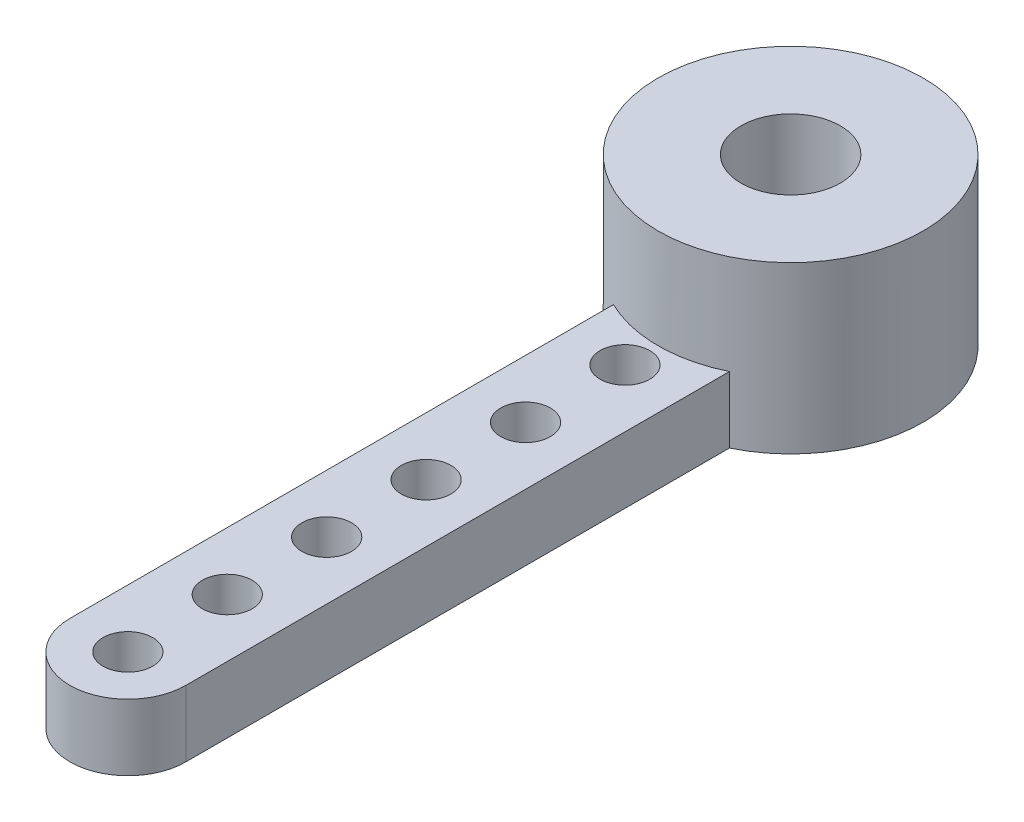
from build123d import *
from build123d.topology import SkipClean

# Parameters (mm, degrees)
SKETCH1_R           = 1.5
BOSS_EXTRUDE1_DEPTH = 10
SKETCH2_R           = 3
CUT_EXTRUDE1_DEPTH  = 6
SKETCH3_R           = 1.5
CUT_EXTRUDE2_DEPTH  = 6
CUT_EXTRUDE4_START  = -6
CUT_EXTRUDE4_DEPTH  = 6


with BuildPart() as part:
    # Sketch1 → Boss-Extrude1 (new body)
    with BuildSketch(Plane(origin=(0, 0, 0), x_dir=(1, 0, 0), z_dir=(0, 1, 0))):
        with BuildLine():
            Line((-3.5, -7.193747285), (-3.5, -40))
            ThreePointArc((-3.5, -40), (0, -43.5), (3.5, -40))
            Line((3.5, -40), (3.5, -7.193747285))
            ThreePointArc((3.5, -7.193747285), (0, 8), (-3.5, -7.193747285))
        make_face()
        with Locations((0, -10)):
            Circle(SKETCH1_R, mode=Mode.SUBTRACT)
        with Locations((0, -34)):
            Circle(SKETCH1_R, mode=Mode.SUBTRACT)
        with Locations((0, -28)):
            Circle(SKETCH1_R, mode=Mode.SUBTRACT)
        with Locations((0, -22)):
            Circle(SKETCH1_R, mode=Mode.SUBTRACT)
        with Locations((0, -40)):
            Circle(SKETCH1_R, mode=Mode.SUBTRACT)
        with Locations((0, -16)):
            Circle(SKETCH1_R, mode=Mode.SUBTRACT)
    extrude(amount=BOSS_EXTRUDE1_DEPTH)

    # Sketch2 → Cut-Extrude1 (cut)
    with BuildSketch(Plane(origin=(0, 10, 0), x_dir=(1, 0, 0), z_dir=(0, 1, 0))):
        Circle(SKETCH2_R)
    extrude(amount=-CUT_EXTRUDE1_DEPTH, mode=Mode.SUBTRACT)

    # Sketch3 → Cut-Extrude2 (cut)
    with BuildSketch(Plane(origin=(0, 4, 0), x_dir=(1, 0, 0), z_dir=(0, 1, 0))):
        Circle(SKETCH3_R)
    extrude(amount=-CUT_EXTRUDE2_DEPTH, mode=Mode.SUBTRACT)

    # Sketch4 → Cut-Extrude4 (cut)
    with SkipClean():  # the faces are left unmerged after this step: merging them gives an invalid solid
        with BuildSketch(Plane(origin=(0, 10, 0), x_dir=(1, 0, 0), z_dir=(0, 1, 0)).offset(CUT_EXTRUDE4_START)):
            with BuildLine():
                Line((3.5, -40), (3.5, -7.193747285))
                ThreePointArc((3.5, -7.193747285), (0, -8), (-3.5, -7.193747285))
                Line((-3.5, -7.193747285), (-3.5, -40))
                ThreePointArc((-3.5, -40), (0, -43.5), (3.5, -40))
            make_face()
        extrude(amount=CUT_EXTRUDE4_DEPTH, mode=Mode.SUBTRACT)


solid = part.part
